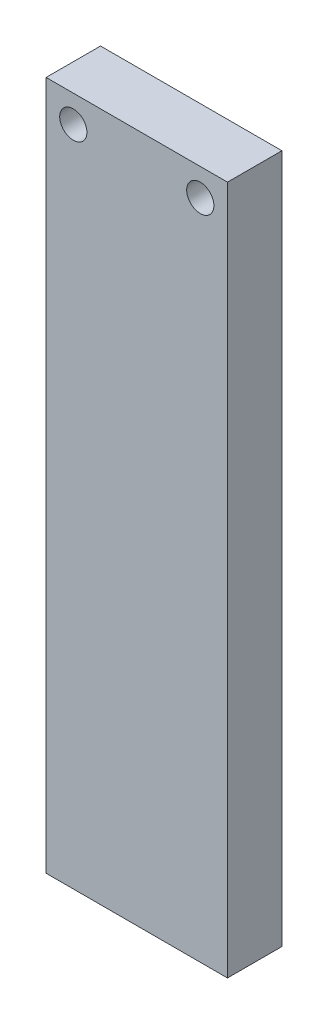
from build123d import *

# Parameters (mm, degrees)
ESQUISSE1_W             = 20
ESQUISSE1_H             = 76
BOSS_EXTRU_1_DEPTH      = 6
ESQUISSE2_R             = 1.5
ENL_V_MAT_EXTRU_1_DEPTH = 6


with BuildPart() as part:
    # Esquisse1 → Boss.-Extru.1 (new body)
    with BuildSketch(Plane.XY):
        Rectangle(ESQUISSE1_W, ESQUISSE1_H)
    extrude(amount=BOSS_EXTRU_1_DEPTH)

    # Esquisse2 → Enlèv. mat.-Extru.1 (cut)
    with BuildSketch(Plane.XY.offset(6)):
        with Locations((-7, 35)):
            Circle(ESQUISSE2_R)
        with Locations((7, 35)):
            Circle(ESQUISSE2_R)
    extrude(amount=-ENL_V_MAT_EXTRU_1_DEPTH, mode=Mode.SUBTRACT)


solid = part.part
